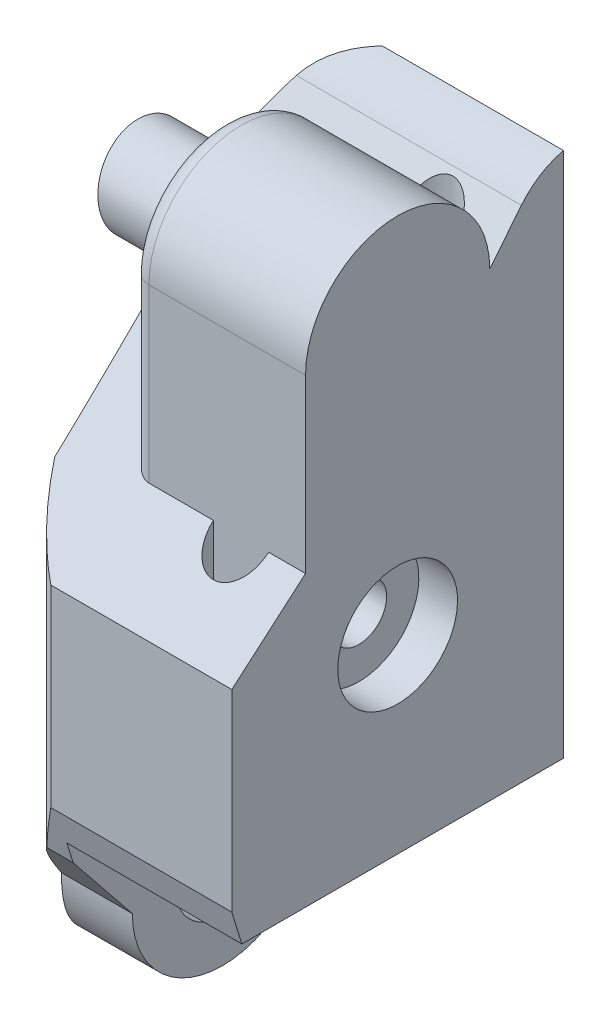
from build123d import *

# Parameters (mm, degrees)
BOSS_EXTRUDE1_DEPTH      = 40
CUT_EXTRUDE1_DEPTH       = 58
CUT_EXTRUDE2_REACH       = 47.222
SKETCH3_W                = 12
SKETCH3_H                = 10
SKETCH4_R                = 2.55
CUT_EXTRUDE3_DEPTH       = 17.5
FILLET4_R                = 2
CUT_EXTRUDE5_START       = -12.324555
SKETCH6_R                = 2.5
CUT_EXTRUDE5_DEPTH       = 9.6
CUT_EXTRUDE6_START       = 6.279445
SKETCH6_3_R              = 2.5
CUT_EXTRUDE6_DEPTH       = 6.604
CUT_EXTRUDE7_START       = -14.986
CUT_EXTRUDE7_DEPTH       = 14.986
CUT_EXTRUDE14_DEPTH      = 10
CUT_EXTRUDE14_DEPTH_BACK = 20
FILLET3_R                = 1
CUT_EXTRUDE17_DEPTH      = 9
CUT_EXTRUDE17_DEPTH_BACK = 31
SKETCH19_W               = 18.14397799
SKETCH19_H               = 52.511082079
SKETCH20_R               = 3.25
CUT_EXTRUDE18_DEPTH      = 2.1
SKETCH21_R               = 1.5
CUT_EXTRUDE19_DEPTH      = 9.1
CUT_EXTRUDE20_DEPTH      = 14
CUT_EXTRUDE20_DEPTH_BACK = 14


with BuildPart() as part:
    # Sketch1 → Boss-Extrude1 (new body)
    with BuildSketch(Plane(origin=(0, 0, 0), x_dir=(1, 0, 0), z_dir=(0, 1, 0))):
        with BuildLine():
            Line((-6.32455532, 9), (6.32455532, 9))
            ThreePointArc((6.32455532, 9), (11, 0), (6.32455532, -9))
            Line((6.32455532, -9), (-6.32455532, -9))
            ThreePointArc((-6.32455532, -9), (-11, 0), (-6.32455532, 9))
        make_face()
    extrude(amount=BOSS_EXTRUDE1_DEPTH)

    # Sketch2 → Cut-Extrude1 (cut)
    with BuildSketch(Plane.XZ):
        with BuildLine():
            Line((1.5, 5), (-1.5, 5))
            ThreePointArc((-1.5, 5), (0, 6.5), (1.5, 5))
        make_face()
        with BuildLine():
            Line((1.5, -5), (-1.5, -5))
            ThreePointArc((-1.5, -5), (0, -6.5), (1.5, -5))
        make_face()
    extrude(amount=-CUT_EXTRUDE1_DEPTH, mode=Mode.SUBTRACT)

    # Cut-Extrude2: up to this face of the body (flat: up to its plane)
    cut_extrude2_end = Plane(part.part.faces().sort_by_distance((0, 20, 9))[0])
    # Sketch3 → Cut-Extrude2 (cut, up to the picked face)
    with BuildSketch(Plane(origin=(0, 0, -9), x_dir=(-1, 0, 0), z_dir=(0, 0, -1)), mode=Mode.PRIVATE) as cut_extrude2_sk1:
        with Locations((0, 5)):
            Rectangle(SKETCH3_W, SKETCH3_H)
    cut_extrude2_tool1 = split(extrude(cut_extrude2_sk1.sketch, amount=-CUT_EXTRUDE2_REACH, mode=Mode.PRIVATE), bisect_by=cut_extrude2_end, keep=Keep.BOTH, mode=Mode.PRIVATE)
    add(cut_extrude2_tool1.solids().sort_by(Axis((0, 5, -9), (0, 0, 1)))[0], mode=Mode.SUBTRACT)

    # Sketch4 → Cut-Extrude3 (cut, symmetric)
    with BuildSketch(Plane.ZY.offset(-6)):
        with Locations(Location((0, 4.9, 0), (0, 0, 270))):
            Circle(SKETCH4_R)
        with BuildLine():
            Line((-9, 10), (-4.9, 4.9))
            ThreePointArc((-4.9, 4.9), (0, 0), (4.9, 4.9))
            Line((4.9, 4.9), (9, 10))
            Line((9, 10), (12.043777938, -1.930413563))
            Line((12.043777938, -1.930413563), (-10.290438773, -1.930413563))
            Line((-10.290438773, -1.930413563), (-9, 10))
        make_face()
    extrude(amount=CUT_EXTRUDE3_DEPTH, both=True, mode=Mode.SUBTRACT)

    # Fillet4
    fillet4_edges = [part.edges().sort_by_distance(p)[0] for p in [
        (0, 10, 5),
        (0, 10, 6.5),
        (0, 10, -5),
        (0, 10, -6.5),
    ]]
    fillet(fillet4_edges, radius=FILLET4_R)

    # Sketch6 → Cut-Extrude5 (cut)
    with BuildSketch(Plane.ZY.offset(6.32455532).offset(CUT_EXTRUDE5_START)):
        with BuildLine():
            Line((9, 22.232353468), (0, 30))
            ThreePointArc((0, 30), (-3.535533906, 31.464466094), (-5, 35))
            Line((-5, 35), (-6.715621335, 37.134065563))
            ThreePointArc((-6.715621335, 37.134065563), (-7.737273484, 38.043034193), (-9, 38.567933069))
            Line((-9, 38.567933069), (-20.985236203, 70.297327945))
            Line((-20.985236203, 70.297327945), (29.827478779, 37.594689174))
            Line((29.827478779, 37.594689174), (9, 22.232353468))
        make_face()
        with Locations((0, 35)):
            Circle(SKETCH6_R, mode=Mode.SUBTRACT)
    extrude(amount=-CUT_EXTRUDE5_DEPTH, mode=Mode.SUBTRACT)

    # Sketch6<3> → Cut-Extrude6 (cut)
    with BuildSketch(Plane.ZY.offset(6.32455532).offset(CUT_EXTRUDE6_START)):
        with BuildLine():
            Line((9, 22.232353468), (0, 30))
            ThreePointArc((0, 30), (-3.535533906, 31.464466094), (-5, 35))
            Line((-5, 35), (-6.715621335, 37.134065563))
            ThreePointArc((-6.715621335, 37.134065563), (-7.737273484, 38.043034193), (-9, 38.567933069))
            Line((-9, 38.567933069), (-20.985236203, 70.297327945))
            Line((-20.985236203, 70.297327945), (29.827478779, 37.594689174))
            Line((29.827478779, 37.594689174), (9, 22.232353468))
        make_face()
        with Locations((0, 35)):
            Circle(SKETCH6_3_R, mode=Mode.SUBTRACT)
    extrude(amount=-CUT_EXTRUDE6_DEPTH, mode=Mode.SUBTRACT)

    # Sketch7 → Cut-Extrude7 (cut)
    with BuildSketch(Plane(origin=(6, 0, 0), x_dir=(0, 0, -1), z_dir=(1, 0, 0)).offset(CUT_EXTRUDE7_START)):
        with BuildLine():
            Line((5, 35), (6.715621335, 37.134065563))
            ThreePointArc((6.715621335, 37.134065563), (7.737273484, 38.043034193), (9, 38.567933069))
            Line((9, 38.567933069), (57.758012517, 25.684640815))
            Line((57.758012517, 25.684640815), (-30.579133969, 55.486762513))
            Line((-30.579133969, 55.486762513), (-9, 22.232353468))
            Line((-9, 22.232353468), (-5, 25.684640815))
            Line((-5, 25.684640815), (-5, 35))
            ThreePointArc((-5, 35), (0, 40), (5, 35))
        make_face()
    extrude(amount=CUT_EXTRUDE7_DEPTH, mode=Mode.SUBTRACT)

    # Sketch16 → Cut-Extrude14 (cut, two sides: drawn at the far end of the back side and taken through both)
    with BuildSketch(Plane.ZY.offset(6.32455532).offset(-CUT_EXTRUDE14_DEPTH_BACK)):
        Polygon((8.113259987, 8.896981935), (11.550119513, 20.031417135), (18.056002312, 15.695207893), (16.156055326, 2.281594324), align=None)
    extrude(amount=CUT_EXTRUDE14_DEPTH + CUT_EXTRUDE14_DEPTH_BACK, mode=Mode.SUBTRACT)

    # Fillet3
    # the kernel refuses this fillet: 1 mm, written as the material it takes off along each edge
    with BuildSketch(Plane(origin=(5.99999968, 23.184640014, 5), x_dir=(-1, 0, 0), z_dir=(0, 1, 0))) as fillet3_piece_1_section:
        with BuildLine():
            CenterArc((FILLET3_R, -FILLET3_R), FILLET3_R, 90, 90)
            Line((0, -FILLET3_R), (0, 0))
            Line((0, 0), (FILLET3_R, 0))
        make_face()
    fillet3_piece_1 = extrude(amount=11.815359986, mode=Mode.PRIVATE)
    fillet3_piece_1 = split(fillet3_piece_1, bisect_by=Plane(origin=(5.764976342, 27.542151825, 2.84779096), z_dir=(0, 0.7570343753275034, 0.653375048936288)), keep=Keep.TOP, mode=Mode.PRIVATE)
    add(fillet3_piece_1, mode=Mode.SUBTRACT)
    with BuildSketch(Plane(origin=(6, 35, 0), x_dir=(0, 0, 1), z_dir=(0, -1, 0))) as fillet3_piece_2_section:
        with BuildLine():
            CenterArc((4, 1.00000032), FILLET3_R, 270, 90)
            ThreePointArc((4, 3.2e-07), (4.5, 3.2e-07), (5, 0))
            Line((5, 0), (5, 1.00000032))
        make_face()
    fillet3_piece_2 = revolve(axis=Axis((6, 35, 0), (-1, 0, 0)), revolution_arc=208.693968336, mode=Mode.PRIVATE)
    fillet3_piece_2 = split(fillet3_piece_2, bisect_by=Plane(origin=(5.717618036, 35.865387036, -5.695703303), z_dir=(0, 0.6265569118246592, 0.7793756708062848)), keep=Keep.TOP, mode=Mode.PRIVATE)
    add(fillet3_piece_2, mode=Mode.SUBTRACT)
    with BuildSketch(Plane(origin=(-6.00000032, 35, 0), x_dir=(0, -0.48013104288571373, -0.8771967747646344), z_dir=(0, -0.8771967747646344, 0.48013104288571373))) as fillet3_piece_3_section:
        with BuildLine():
            CenterArc((5 - FILLET3_R, FILLET3_R), FILLET3_R, 270, 90)
            Line((5 - FILLET3_R, 0), (5, 0))
            Line((5, 0), (5, FILLET3_R))
        make_face()
    fillet3_piece_3 = revolve(axis=Axis((-6.00000032, 35, 0), (1, 0, 0)), revolution_arc=208.69396098, mode=Mode.PRIVATE)
    fillet3_piece_3 = split(fillet3_piece_3, bisect_by=Plane(origin=(-5.717618693, 35.865387047, -5.695703312), z_dir=(0, 0.6265569118246592, 0.7793756708062848)), keep=Keep.TOP, mode=Mode.PRIVATE)
    add(fillet3_piece_3, mode=Mode.SUBTRACT)
    with BuildSketch(Plane(origin=(-6.00000032, 35, 5), x_dir=(0, 0, -1), z_dir=(0, -1, 0))) as fillet3_piece_4_section:
        with BuildLine():
            CenterArc((FILLET3_R, FILLET3_R), FILLET3_R, 180, 90)
            Line((0, FILLET3_R), (0, 0))
            Line((0, 0), (FILLET3_R, 0))
        make_face()
    fillet3_piece_4 = extrude(amount=11.815359185, mode=Mode.PRIVATE)
    fillet3_piece_4 = split(fillet3_piece_4, bisect_by=Plane(origin=(-5.831638777, 29.468233552, 0.616132314), z_dir=(0, 0.7570343753275034, 0.653375048936288)), keep=Keep.TOP, mode=Mode.PRIVATE)
    add(fillet3_piece_4, mode=Mode.SUBTRACT)

    # Sketch19 → Cut-Extrude17 (cut, two sides: drawn at the far end of the back side and taken through both)
    with BuildSketch(Plane.XY.offset(5).offset(-CUT_EXTRUDE17_DEPTH_BACK)):
        with Locations((12.571988995, 20.723484304)):
            Rectangle(SKETCH19_W, SKETCH19_H)
    extrude(amount=CUT_EXTRUDE17_DEPTH + CUT_EXTRUDE17_DEPTH_BACK, mode=Mode.SUBTRACT)

    # Sketch20 → Cut-Extrude18 (cut)
    with BuildSketch(Plane(origin=(3.5, 0, 0), x_dir=(0, 0, -1), z_dir=(1, 0, 0))):
        with Locations(Location((0, 20.3, 0), (0, 0, 90))):
            Circle(SKETCH20_R)
    extrude(amount=-CUT_EXTRUDE18_DEPTH, mode=Mode.SUBTRACT)

    # Sketch21 → Cut-Extrude19 (cut)
    with BuildSketch(Plane(origin=(1.4, 0, 0), x_dir=(0, 0, -1), z_dir=(1, 0, 0))):
        with Locations(Location((0, 20.3, 0), (0, 0, 90))):
            Circle(SKETCH21_R)
    extrude(amount=-CUT_EXTRUDE19_DEPTH, mode=Mode.SUBTRACT)

    # Sketch17 → Cut-Extrude20 (cut, two sides: drawn at the far end of the back side and taken through both)
    with BuildSketch(Plane.XY.offset(-CUT_EXTRUDE20_DEPTH_BACK)):
        with BuildLine():
            Line((11, 0), (21.82042967, 52.006672347))
            Line((21.82042967, 52.006672347), (-19.981455648, 54.836748038))
            Line((-19.981455648, 54.836748038), (-22.103338511, 10.056999989))
            Line((-22.103338511, 10.056999989), (-11, 0))
            ThreePointArc((-11, 0), (-9.292734081, 20), (-11, 40))
            Line((-11, 40), (-14.776436098, 42.476608752))
            Line((-14.776436098, 42.476608752), (-7.177261686, 49.84322342))
            Line((-7.177261686, 49.84322342), (9.09969288, 46.456664847))
            Line((9.09969288, 46.456664847), (16.101427872, 37.54860329))
            Line((16.101427872, 37.54860329), (11, 40))
            ThreePointArc((11, 40), (9.292734081, 20), (11, 0))
        make_face()
    extrude(amount=CUT_EXTRUDE20_DEPTH + CUT_EXTRUDE20_DEPTH_BACK, mode=Mode.SUBTRACT)


solid = part.part
